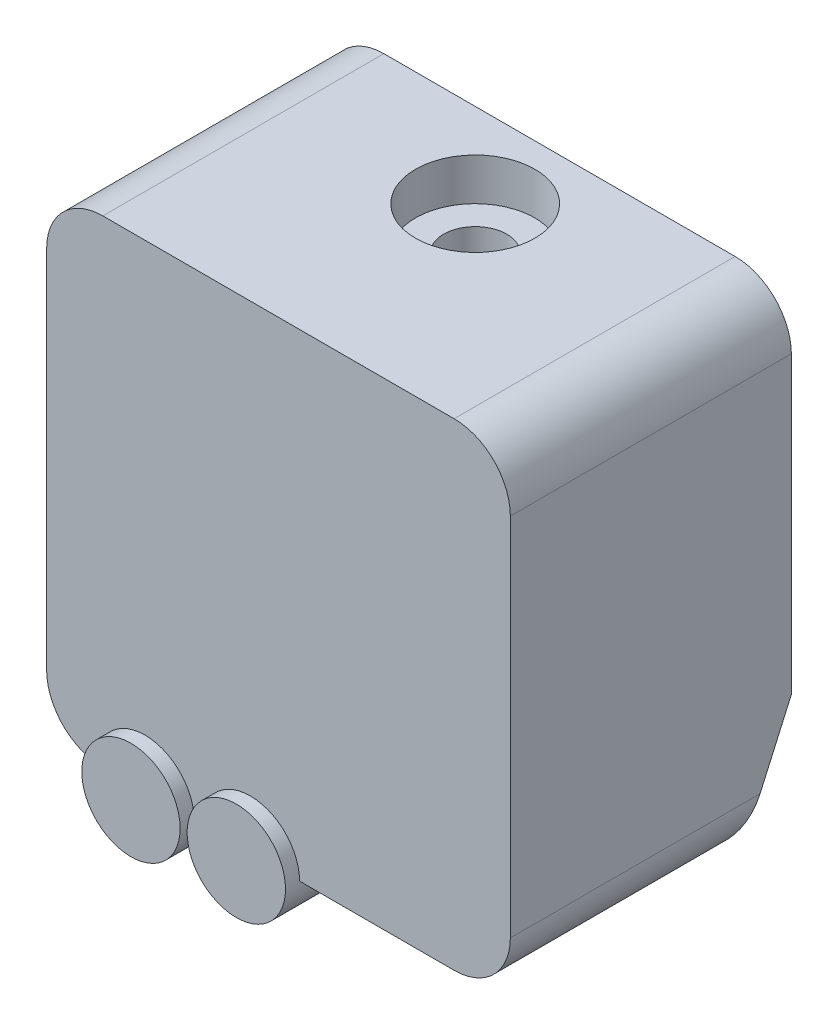
from build123d import *

# Parameters (mm, degrees)
SKETCH1_W                 = 4
SKETCH1_H                 = 32
SKETCH2_W                 = 33
SKETCH2_H                 = 34
BOSS_EXTRUDE1_DEPTH       = 20
FILLET1_R                 = 4
SKETCH6_R                 = 3.5
BOSS_EXTRUDE5_DEPTH       = 21
BOSS_EXTRUDE4_DEPTH       = 5
BOSS_EXTRUDE6_DEPTH       = 24
BOSS_EXTRUDE6_DEPTH_BACK  = 29
CHAMFER1_SIZE             = 2.5
CHAMFER1_SIZE2            = 1.443375673
CUT_EXTRUDE1_DEPTH        = 5
SKETCH11_R                = 15
BOSS_EXTRUDE7_DEPTH       = 5
REVOLVE2_ANGLE            = 31
SKETCH14_W                = 100
SKETCH14_H                = 5
CUT_EXTRUDE3_DEPTH        = 71.072541008
CUT_EXTRUDE4_DEPTH        = 128.360121498
FILLET2_R                 = 2
SKETCH16_R                = 14
BOSS_EXTRUDE8_DEPTH       = 1
SKETCH17_W                = 3
SKETCH17_H                = 10
BOSS_EXTRUDE9_DEPTH       = 10
FILLET3_R                 = 5
BOSS_EXTRUDE10_DEPTH      = 11
BOSS_EXTRUDE10_DEPTH_BACK = 11
SKETCH18_R                = 2.5
BOSS_EXTRUDE11_DEPTH      = 7
BOSS_EXTRUDE11_DEPTH_BACK = 7
CUT_EXTRUDE6_DEPTH        = 150.910272613
CUT_EXTRUDE7_DEPTH        = 148.336654753
CUT_EXTRUDE8_START        = -10
CUT_EXTRUDE8_DEPTH        = 10
BOSS_EXTRUDE14_DEPTH      = 11.5
BOSS_EXTRUDE14_DEPTH_BACK = 11.5
SKETCH29_W                = 4
SKETCH29_H                = 5.8
CUT_EXTRUDE9_DEPTH        = 129.091218174
SKETCH30_R                = 1.75
CUT_EXTRUDE10_DEPTH       = 142.472046033
SKETCH31_W                = 39
SKETCH31_H                = 24.998947646
CUT_EXTRUDE11_DEPTH       = 20
CUT_EXTRUDE12_DEPTH       = 29.977320805
CUT_EXTRUDE12_DEPTH_BACK  = 3
SKETCH32_W                = 2.5
SKETCH32_H                = 20
SKETCH33_W                = 8
SKETCH33_H                = 24
CUT_EXTRUDE13_DEPTH       = 3
SKETCH26_R                = 10.5
CUT_EXTRUDE14_DEPTH       = 1
SKETCH34_R                = 0.5
CUT_EXTRUDE15_DEPTH       = 5
CIRPATTERN1_COUNT         = 4
SKETCH35_R                = 3.75
CUT_EXTRUDE16_DEPTH       = 5
CUT_EXTRUDE17_REACH       = 90.337
SKETCH36_W                = 4
SKETCH36_H                = 20
BOSS_EXTRUDE15_DEPTH      = 14
CHAMFER2_SIZE             = 1
CUT_EXTRUDE18_START       = -22.5
CUT_EXTRUDE18_DEPTH       = 7.245247294
CUT_EXTRUDE19_DEPTH       = 137.865224972
CUT_EXTRUDE19_DEPTH_BACK  = 137.865224972
SKETCH40_W                = 5
SKETCH40_H                = 33.621320344
CUT_EXTRUDE20_DEPTH       = 103.304691975
SKETCH41_W                = 23
SKETCH41_H                = 24
CUT_EXTRUDE21_DEPTH       = 15
CUT_EXTRUDE22_REACH       = 49.482
SKETCH42_R                = 2.25
SKETCH43_R                = 4.25
CUT_EXTRUDE23_DEPTH       = 3


# Read off the part's stored shape, not the designer's step: Cut-Extrude18
with BuildPart() as part:
    # Sketch1 → Revolve1 (revolve)
    with BuildSketch(Plane(origin=(0, 0, 0), x_dir=(0, 0, -1), z_dir=(1, 0, 0)), mode=Mode.PRIVATE) as revolve1_sk:
        with Locations((26, 97)):
            Rectangle(SKETCH1_W, SKETCH1_H)
    revolve(revolve1_sk.sketch.rotate(Axis((0, 81, -24), (0, 0, -1)), 90), axis=Axis((0, 81, -24), (0, 0, -1)))

    # Sketch2 → Boss-Extrude1 (add)
    with BuildSketch(Plane.XY.offset(-24)):
        with Locations((0, 81)):
            Rectangle(SKETCH2_W, SKETCH2_H)
    extrude(amount=BOSS_EXTRUDE1_DEPTH)

    # Fillet1
    fillet1_edges = [part.edges().sort_by_distance(p)[0] for p in [
        (-16.5, 98, -14),
        (-16.5, 64, -14),
        (16.5, 64, -14),
        (16.5, 98, -14),
    ]]
    fillet(fillet1_edges, radius=FILLET1_R)

    # Sketch6 → Boss-Extrude5 (add)
    with BuildSketch(Plane.XY.offset(-24)):
        with Locations((-9.5, 64)):
            Circle(SKETCH6_R)
        with Locations((-2, 64)):
            Circle(SKETCH6_R)
    extrude(amount=BOSS_EXTRUDE5_DEPTH)

    # Sketch5 → Boss-Extrude4 (add)
    with BuildSketch(Plane.ZY.offset(16.5)):
        with BuildLine():
            Line((-24, 95.878679656), (-24, 65.878679656))
            Line((-24, 65.878679656), (-24, 64.378679656))
            Line((-24, 64.378679656), (-18, 64.378679656))
            ThreePointArc((-18, 64.378679656), (-13.407206732, 65.949409044), (-10.738156226, 70.003679656))
            ThreePointArc((-10.738156226, 70.003679656), (-9.778946909, 76.271114557), (-10.094291182, 82.603679656))
            ThreePointArc((-10.094291182, 82.603679656), (-10.614769033, 84.232569851), (-11.617642296, 85.617642296))
            Line((-11.617642296, 85.617642296), (-22.939339828, 96.939339828))
            Line((-22.939339828, 96.939339828), (-24, 98))
            Line((-24, 98), (-24, 95.878679656))
        make_face()
    boss_extrude4 = extrude(amount=BOSS_EXTRUDE4_DEPTH)

    # Mirror1: Boss-Extrude4 across plane
    add(boss_extrude4.mirror(Plane(origin=(0, 0, 0), x_dir=(0, 0, 1), z_dir=(1, 0, 0))))

    # Sketch8 → Boss-Extrude6 (add, two sides: drawn at the far end of the back side and taken through both)
    with BuildSketch(Plane(origin=(0, 0, 0), x_dir=(0, 0, -1), z_dir=(1, 0, 0)).offset(-BOSS_EXTRUDE6_DEPTH_BACK)):
        with BuildLine():
            Line((31.001853199, 75.687759622), (24, 73))
            Line((24, 73), (17.208840641, 57.746806342))
            ThreePointArc((17.208840641, 57.746806342), (17.088630828, 53.156178786), (20.249693528, 49.825113738))
            Line((20.249693528, 49.825113738), (51.254059511, 36.021080632))
            Line((51.254059511, 36.021080632), (56.33826755, 47.440398853))
            Line((56.33826755, 47.440398853), (58.041837372, 63.648783017))
            Line((58.041837372, 63.648783017), (31.001853199, 75.687759622))
        make_face()
    extrude(amount=BOSS_EXTRUDE6_DEPTH + BOSS_EXTRUDE6_DEPTH_BACK)

    # Chamfer1
    chamfer1_edges = [part.edges().sort_by_distance(p)[0] for p in [
        (-29, 42.923097185, -35.75187652),
        (-29, 53.156178786, -17.088630828),
        (-29, 65.373403171, -20.60442032),
    ]]
    chamfer1_side = [part.faces().sort_by_distance(p)[0] for p in [
        (-29, 56.351609178, -38.570530073),
    ]]
    chamfer(chamfer1_edges, length=CHAMFER1_SIZE, length2=CHAMFER1_SIZE2, reference=chamfer1_side[0])

    # Sketch10 → Cut-Extrude1 (cut)
    with BuildSketch(Plane(origin=(0, 49.106538634, -21.863639636), x_dir=(1, 0, 0), z_dir=(0, -0.9135454576426004, 0.40673664307580126))):
        Polygon((19, 7.766683961), (-19, 7.766683961), (-19, 1.766683961), (-25, 1.766683961), (-25, -28.171819836), (19, -28.171819836), align=None)
    extrude(amount=-CUT_EXTRUDE1_DEPTH, mode=Mode.SUBTRACT)

    # Sketch11 → Boss-Extrude7 (add)
    with BuildSketch(Plane(origin=(0, 53.674265922, -23.897322851), x_dir=(1, 0, 0), z_dir=(0, -0.9135454576426004, 0.4067366430758013))):
        with Locations(Location((0, -11, 0), (0, 0, 90))):
            Circle(SKETCH11_R)
    extrude(amount=BOSS_EXTRUDE7_DEPTH)

    # Sketch12 → Revolve2 (revolve)
    with BuildSketch(Plane(origin=(0, -17.846986098, -49.476286882), x_dir=(-1, 0, 0), z_dir=(0, -0.10452846326764662, -0.9945218953682741))):
        with BuildLine():
            Line((-47.333333333, 89.657262738), (-50, 86.675838768))
            ThreePointArc((-50, 86.675838768), (0, 67.577538205), (50, 86.675838768))
            Line((50, 86.675838768), (47.333333333, 89.657262738))
            ThreePointArc((47.333333333, 89.657262738), (0, 71.577538205), (-47.333333333, 89.657262738))
        make_face()
    revolve(axis=Axis((0, 118.976887958, -63.857055531), (-1, 0, 0)), revolution_arc=REVOLVE2_ANGLE)

    # Sketch14 → Cut-Extrude3 (cut, through all)
    with BuildSketch(Plane(origin=(0, 74.685811448, -33.252265642), x_dir=(1, 0, 0), z_dir=(0, 0.9135454576425986, -0.40673664307580537))):
        with Locations((0, -2.5)):
            Rectangle(SKETCH14_W, SKETCH14_H)
    extrude(amount=CUT_EXTRUDE3_DEPTH, mode=Mode.SUBTRACT)

    # Sketch15 → Cut-Extrude4 (cut, through all)
    with BuildSketch(Plane(origin=(0, 0, -28), x_dir=(-1, 0, 0), z_dir=(0, 0, -1))):
        with BuildLine():
            Line((-31.513326273, 86.559700282), (-55.043150404, 86.559700282))
            Line((-55.043150404, 86.559700282), (-29.919773925, 69.65067719))
            ThreePointArc((-29.919773925, 69.65067719), (-31.858832613, 77.997536923), (-31.513326273, 86.559700282))
        make_face()
        with BuildLine():
            Line((55.043150404, 86.559700282), (29.919773925, 69.65067719))
            ThreePointArc((29.919773925, 69.65067719), (31.858832613, 77.997536923), (31.513326273, 86.559700282))
            Line((31.513326273, 86.559700282), (55.043150404, 86.559700282))
        make_face()
    extrude(amount=-CUT_EXTRUDE4_DEPTH, mode=Mode.SUBTRACT)

    # Fillet2
    fillet2_edges = [part.edges().sort_by_distance(p)[0] for p in [
        (48.666185859, 78.806391764, -35.086866199),
        (-48.666185859, 78.806391764, -35.086866199),
    ]]
    fillet(fillet2_edges, radius=FILLET2_R)

    # Sketch16 → Boss-Extrude8 (add)
    with BuildSketch(Plane(origin=(0, 49.106538634, -21.863639636), x_dir=(1, 0, 0), z_dir=(0, -0.9135454576426004, 0.4067366430758013))):
        with Locations(Location((0, -11, 0), (0, 0, 270))):
            Circle(SKETCH16_R)
    extrude(amount=BOSS_EXTRUDE8_DEPTH)

    # Sketch17 → Boss-Extrude9 (add)
    with BuildSketch(Plane(origin=(0, 48.192993176, -21.456902993), x_dir=(1, 0, 0), z_dir=(0, -0.9135454576426004, 0.4067366430758013))):
        with Locations((-8.5, -11)):
            Rectangle(SKETCH17_W, SKETCH17_H)
        with Locations((8.5, -11)):
            Rectangle(SKETCH17_W, SKETCH17_H)
    extrude(amount=BOSS_EXTRUDE9_DEPTH)

    # Fillet3
    fillet3_edges = [part.edges().sort_by_distance(p)[0] for p in [
        (8.5, 32.549752311, -32.006263885),
        (8.5, 36.617118741, -22.870809308),
        (-8.5, 32.549752311, -32.006263885),
        (-8.5, 36.617118741, -22.870809308),
    ]]
    fillet(fillet3_edges, radius=FILLET3_R - 0.0001)  # a hair under: the kernel refuses the full size

    # Sketch18 → Boss-Extrude10 (add, two sides: drawn at the far end of the back side and taken through both)
    with BuildSketch(Plane(origin=(0, 0, 0), x_dir=(0, 0, -1), z_dir=(1, 0, 0)).offset(-BOSS_EXTRUDE10_DEPTH_BACK)):
        with Locations((29.472219812, 39.151162814)):
            Circle(SKETCH18_R)
    extrude(amount=BOSS_EXTRUDE10_DEPTH + BOSS_EXTRUDE10_DEPTH_BACK)

    # Sketch19 → Boss-Extrude11 (add, two sides: drawn at the far end of the back side and taken through both)
    with BuildSketch(Plane(origin=(0, 0, 0), x_dir=(0, 0, -1), z_dir=(1, 0, 0)).offset(-BOSS_EXTRUDE11_DEPTH_BACK)):
        Polygon((-9.858637787, 19.29122893), (27.352542755, 42.543355199), (36.583230482, 48.311329057), (40.822584596, 41.526944287), (31.591896869, 35.75897043), (-9.536250046, 10.059251922), align=None)
    extrude(amount=BOSS_EXTRUDE11_DEPTH + BOSS_EXTRUDE11_DEPTH_BACK)

    # Sketch22 → Cut-Extrude6 (cut, through all)
    with BuildSketch(Plane.ZY.offset(29)):
        Polygon((-33.862459198, 76.056328613), (-26.096721215, 58.614195528), (-25.276378018, 67.77859965), (-28, 71.392968097), (-29.918482828, 83.52797246), align=None)
    extrude(amount=CUT_EXTRUDE6_DEPTH, mode=Mode.SUBTRACT)

    # Sketch24 → Cut-Extrude7 (cut, through all)
    with BuildSketch(Plane(origin=(24, 0, 0), x_dir=(0, 0, -1), z_dir=(1, 0, 0))):
        Polygon((33.862459198, 76.056328613), (28.211358934, 63.363749607), (28, 63.363749607), (28, 74.53545614), (31.001853199, 75.687759622), align=None)
    extrude(amount=CUT_EXTRUDE7_DEPTH, mode=Mode.SUBTRACT)

    # Sketch25 → Cut-Extrude8 (cut)
    with BuildSketch(Plane(origin=(0, 0, -28), x_dir=(-1, 0, 0), z_dir=(0, 0, -1)).offset(CUT_EXTRUDE8_START)):
        with BuildLine():
            Line((-32.5084646, 71.392968097), (-38.134327203, 71.392968097))
            add(Edge.make_bspline(
                [(-38.134327203, 71.392968097), (-36.477248939, 70.167781572), (-34.767119143, 69.014339761), (-33.008804526, 67.935816953), (-30.373035757, 66.471137376), (-29.529410915, 66.024103649), (-28.677053697, 65.593954957), (-27.816482516, 65.18091973)],
                knots=[0, 0, 0, 0, 0, 0.507824521, 0.507824521, 0.507824521, 0.743043932, 0.743043932, 0.743043932, 0.743043932, 0.743043932], degree=4))
            ThreePointArc((-27.816482515, 65.180919733), (-28.954507591, 67.375151739), (-29.919773925, 69.65067719))
            Line((-29.919773925, 69.65067719), (-32.5084646, 71.392968097))
        make_face()
    extrude(amount=CUT_EXTRUDE8_DEPTH, mode=Mode.SUBTRACT)

    # Sketch27 → Cut-Revolve1 (revolve, cut)
    with BuildSketch(Plane(origin=(0, 0, 0), x_dir=(0, 0, -1), z_dir=(1, 0, 0))):
        Polygon((28, 64), (68, 53.282032303), (68, 76), (28, 76), align=None)
    revolve(axis=Axis((0, 90, -38), (0, 0, -1)), mode=Mode.SUBTRACT)

    # Sketch28 → Boss-Extrude14 (add, two sides: drawn at the far end of the back side and taken through both)
    with BuildSketch(Plane(origin=(0, 0, 0), x_dir=(0, 0, -1), z_dir=(1, 0, 0)).offset(-BOSS_EXTRUDE14_DEPTH_BACK)):
        Polygon((-9.858637787, 19.29122893), (-5.619283673, 12.506844161), (-14.099764635, 7.207651518), (-18.339118749, 13.992036288), align=None)
    extrude(amount=BOSS_EXTRUDE14_DEPTH + BOSS_EXTRUDE14_DEPTH_BACK)

    # Sketch29 → Cut-Extrude9 (cut, through all)
    with BuildSketch(Plane(origin=(0, 18.304416013, 11.437868571), x_dir=(1, 0, 0), z_dir=(0, 0.8480480961564255, 0.5299192642332059))):
        with Locations((6.5, -3.137805165)):
            Rectangle(SKETCH29_W, SKETCH29_H)
        with Locations((-6.5, -3.137805165)):
            Rectangle(SKETCH29_W, SKETCH29_H)
    extrude(amount=-CUT_EXTRUDE9_DEPTH, mode=Mode.SUBTRACT)

    # Sketch30 → Cut-Extrude10 (cut, through all)
    with BuildSketch(Plane(origin=(11.5, 0, 0), x_dir=(0, 0, -1), z_dir=(1, 0, 0))):
        with Locations((-11.979201211, 13.249440224)):
            Circle(SKETCH30_R)
    extrude(amount=-CUT_EXTRUDE10_DEPTH, mode=Mode.SUBTRACT)

    # Sketch31 → Cut-Extrude11 (cut)
    with BuildSketch(Plane(origin=(0, 74.685811448, -33.252265642), x_dir=(1, 0, 0), z_dir=(0, 0.9135454576425989, -0.40673664307580487))):
        with Locations((-4.5, 10.036090721)):
            Rectangle(SKETCH31_W, SKETCH31_H)
    extrude(amount=-CUT_EXTRUDE11_DEPTH, mode=Mode.SUBTRACT)

    # Sketch32 → Cut-Extrude12 (cut, two sides: drawn at the far end of the back side and taken through both)
    with BuildSketch(Plane(origin=(0, 1.001948174, 2.250412443), x_dir=(-1, 0, 0), z_dir=(0, -0.4067366430758048, -0.9135454576425989)).offset(-CUT_EXTRUDE12_DEPTH_BACK)):
        with Locations((3.25, 71.753798701)):
            Rectangle(SKETCH32_W, SKETCH32_H)
    extrude(amount=CUT_EXTRUDE12_DEPTH + CUT_EXTRUDE12_DEPTH_BACK, mode=Mode.SUBTRACT)

    # Sketch33 → Cut-Extrude13 (cut)
    with BuildSketch(Plane(origin=(0, 56.414902295, -25.117532781), x_dir=(1, 0, 0), z_dir=(0, 0.9135454576425986, -0.4067366430758051))):
        with Locations((-19, 10.233316039)):
            Rectangle(SKETCH33_W, SKETCH33_H)
    extrude(amount=-CUT_EXTRUDE13_DEPTH, mode=Mode.SUBTRACT)

    # Sketch26 → Cut-Extrude14 (cut)
    with BuildSketch(Plane(origin=(0, 0, -28), x_dir=(-1, 0, 0), z_dir=(0, 0, -1))):
        with Locations((0, 81)):
            Circle(SKETCH26_R)
    extrude(amount=-CUT_EXTRUDE14_DEPTH, mode=Mode.SUBTRACT)

    # Sketch34 → Cut-Extrude15 (cut)
    with BuildSketch(Plane(origin=(0, 0, -27), x_dir=(-1, 0, 0), z_dir=(0, 0, -1))):
        with Locations((-3, 88.5)):
            Circle(SKETCH34_R)
        with Locations((0, 88.5)):
            Circle(SKETCH34_R)
        with Locations((3, 88.5)):
            Circle(SKETCH34_R)
    cut_extrude15 = extrude(amount=-CUT_EXTRUDE15_DEPTH, mode=Mode.SUBTRACT)

    # CirPattern1: Cut-Extrude15 ×4 about axis
    cirpattern1_axis = Axis((0, 81, 0), (0, 0, 1))
    for i in range(1, CIRPATTERN1_COUNT):
        add(cut_extrude15.rotate(cirpattern1_axis, i * 360 / CIRPATTERN1_COUNT), mode=Mode.SUBTRACT)

    # Sketch35 → Cut-Extrude16 (cut)
    with BuildSketch(Plane(origin=(0, 0, -27), x_dir=(-1, 0, 0), z_dir=(0, 0, -1))):
        with Locations((0, 81)):
            Circle(SKETCH35_R)
    extrude(amount=-CUT_EXTRUDE16_DEPTH, mode=Mode.SUBTRACT)

    # Sketch36 → Cut-Extrude17 (cut, up to next)
    with BuildSketch(Plane(origin=(0, 53.674265922, -23.897322851), x_dir=(1, 0, 0), z_dir=(0, -0.9135454576426004, 0.4067366430758015)), mode=Mode.PRIVATE) as cut_extrude17_sk1:
        with Locations((17, -11)):
            Rectangle(SKETCH36_W, SKETCH36_H)
    cut_extrude17_tool1 = extrude(cut_extrude17_sk1.sketch, amount=-CUT_EXTRUDE17_REACH, mode=Mode.PRIVATE) & part.part
    add(cut_extrude17_tool1.solids().sort_by_distance((17, 49.200163, -33.946323))[0], mode=Mode.SUBTRACT)

    # Sketch37 → Boss-Extrude15 (add)
    with BuildSketch(Plane(origin=(-7, 0, 0), x_dir=(0, 0, -1), z_dir=(1, 0, 0))):
        with BuildLine():
            Line((26.938175739, 45.752573318), (24.904492523, 41.18484603))
            ThreePointArc((24.904492523, 41.18484603), (24.854997538, 41.069823408), (24.808398466, 40.953597406))
            Line((24.808398466, 40.953597406), (30.179134274, 44.30960561))
            Line((30.179134274, 44.30960561), (26.938175739, 45.752573318))
        make_face()
    extrude(amount=BOSS_EXTRUDE15_DEPTH)

    # Chamfer2
    chamfer2_edges = [part.edges().sort_by_distance(p)[0] for p in [
        (3.275817755, 90.975921914, -28),
    ]]
    chamfer(chamfer2_edges, length=CHAMFER2_SIZE - 0.0001)  # a hair under: the kernel refuses the full size

    # Cut-Extrude18 outline → Cut-Extrude18 (cut)
    with BuildSketch(Plane.YZ.offset(CUT_EXTRUDE18_START)):
        Polygon((68.945486948, -28), (75.687759622, -31.001853199), (74.53545614, -28), align=None)
    extrude(amount=CUT_EXTRUDE18_DEPTH, mode=Mode.SUBTRACT)

    # Sketch39 → Cut-Extrude19 (cut, two sides: drawn at the far end of the back side and taken through both)
    with BuildSketch(Plane(origin=(0, 0, 0), x_dir=(0, 0, -1), z_dir=(1, 0, 0)).offset(-CUT_EXTRUDE19_DEPTH_BACK)):
        Polygon((24, 113), (24, 73), (18.434641434, 60.5), (3, 60.5), (-18.339118749, 13.992036288), (-14.099764635, 7.207651518), (51.254059511, 36.021080632), (56.33826755, 47.440398853), (58.848022777, 71.319124773), (28, 113), align=None)
    extrude(amount=CUT_EXTRUDE19_DEPTH + CUT_EXTRUDE19_DEPTH_BACK, mode=Mode.SUBTRACT)

    # Sketch40 → Cut-Extrude20 (cut, through all)
    with BuildSketch(Plane.XY.offset(-4)):
        with Locations((-19, 81.189339828)):
            Rectangle(SKETCH40_W, SKETCH40_H)
        with Locations((19, 81.189339828)):
            Rectangle(SKETCH40_W, SKETCH40_H)
    extrude(amount=-CUT_EXTRUDE20_DEPTH, mode=Mode.SUBTRACT)

    # Sketch41 → Cut-Extrude21 (cut)
    with BuildSketch(Plane(origin=(0, 0, -24), x_dir=(-1, 0, 0), z_dir=(0, 0, -1))):
        with Locations((0, 81)):
            Rectangle(SKETCH41_W, SKETCH41_H)
    extrude(amount=-CUT_EXTRUDE21_DEPTH, mode=Mode.SUBTRACT)

    # Sketch42 → Cut-Extrude22 (cut, up to next)
    with BuildSketch(Plane(origin=(0, 98, 0), x_dir=(1, 0, 0), z_dir=(0, 1, 0)), mode=Mode.PRIVATE) as cut_extrude22_sk1:
        with Locations(Location((0, 18, 0), (0, 0, 270))):
            Circle(SKETCH42_R)
    cut_extrude22_tool1 = extrude(cut_extrude22_sk1.sketch, amount=-CUT_EXTRUDE22_REACH, mode=Mode.PRIVATE) & part.part
    add(cut_extrude22_tool1.solids().sort_by_distance((0, 98, -18))[0], mode=Mode.SUBTRACT)

    # Sketch43 → Cut-Extrude23 (cut)
    with BuildSketch(Plane(origin=(0, 98, 0), x_dir=(1, 0, 0), z_dir=(0, 1, 0))):
        with Locations(Location((0, 18, 0), (0, 0, 270))):
            Circle(SKETCH43_R)
    extrude(amount=-CUT_EXTRUDE23_DEPTH, mode=Mode.SUBTRACT)


solid = part.part
